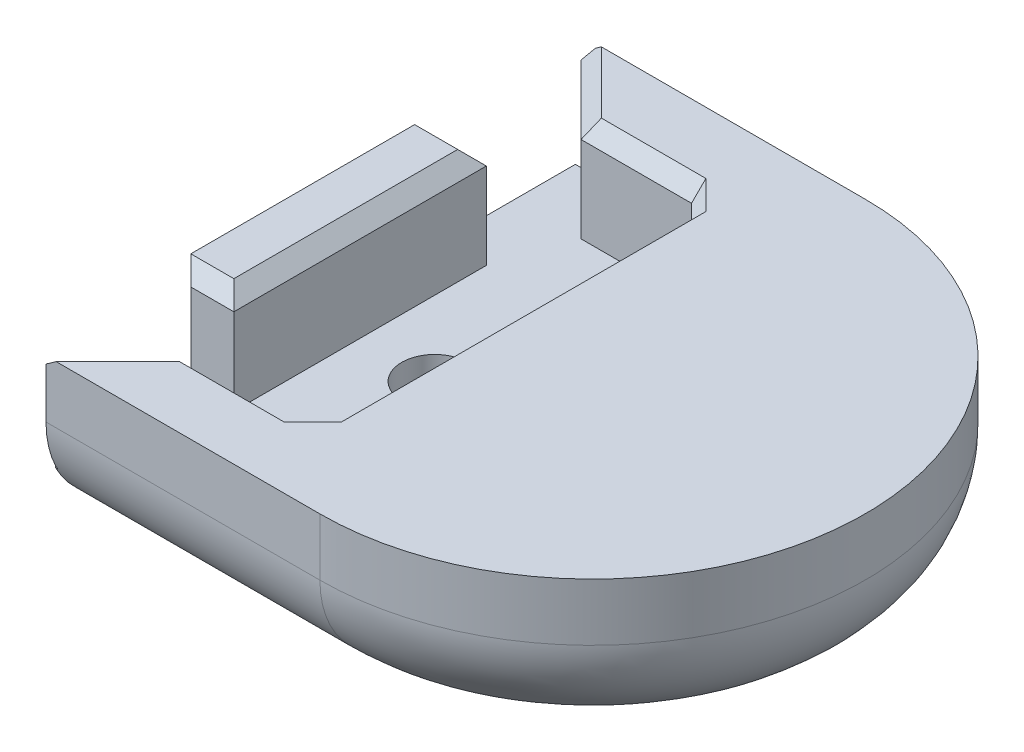
from build123d import *
from OCP.BRepFilletAPI import BRepFilletAPI_MakeChamfer

# Parameters (mm, degrees)
BOSS_EXTRUDE1_DEPTH     = 2
BOSS_EXTRUDE2_START     = 3.5
BOSS_EXTRUDE2_DEPTH     = 3.5
CUT_EXTRUDE1_DEPTH      = 15.300699284
CUT_EXTRUDE1_DEPTH_BACK = 15.300699284
SKETCH4_R               = 1.15
CUT_EXTRUDE2_DEPTH      = 1
CHAMFER1_SIZE           = 0.5
CHAMFER1_SIZE2          = 0.353553391
FILLET1_R               = 3.5
CHAMFER2_SIZE           = 0.5


with BuildPart() as part:
    # Sketch1 → Boss-Extrude1 (new body)
    with BuildSketch(Plane(origin=(0, 0, 0), x_dir=(1, 0, 0), z_dir=(0, 1, 0))):
        with BuildLine():
            Line((-10.1, -4.5), (-10.1, 4.5))
            Line((-10.1, 4.5), (-10.1, 9.5))
            Line((-10.1, 9.5), (0, 9.5))
            ThreePointArc((0, 9.5), (9.5, 0), (0, -9.5))
            Line((0, -9.5), (-10.1, -9.5))
            Line((-10.1, -9.5), (-10.1, -4.5))
        make_face()
    extrude(amount=-BOSS_EXTRUDE1_DEPTH)

    # Sketch2 → Boss-Extrude2 (add)
    with BuildSketch(Plane(origin=(0, 0, 0), x_dir=(1, 0, 0), z_dir=(0, 1, 0)).offset(BOSS_EXTRUDE2_START)):
        Polygon((-10.1, 4.4), (-8.1, 4.4), (-8.1, -4.4), (-10.1, -4.4), (-10.1, 0), align=None)
        with BuildLine():
            Line((-9.9, 9.5), (-7.25, 6.85))
            Line((-7.25, 6.85), (-2.9, 6.85))
            Line((-2.9, 6.85), (-2.9, -6.85))
            Line((-2.9, -6.85), (-7.25, -6.85))
            Line((-7.25, -6.85), (-9.9, -9.5))
            Line((-9.9, -9.5), (0, -9.5))
            ThreePointArc((0, -9.5), (9.5, 0), (0, 9.5))
            Line((0, 9.5), (-9.9, 9.5))
        make_face()
    extrude(amount=-BOSS_EXTRUDE2_DEPTH)

    # Sketch4 → Cut-Extrude1 (cut, two sides: drawn at the far end of the back side and taken through both)
    with BuildSketch(Plane(origin=(0, 0, 0), x_dir=(1, 0, 0), z_dir=(0, 1, 0)).offset(-CUT_EXTRUDE1_DEPTH_BACK)):
        with Locations(Location((-5.5, 0, 0), (0, 0, 270))):
            Circle(SKETCH4_R)
    extrude(amount=CUT_EXTRUDE1_DEPTH + CUT_EXTRUDE1_DEPTH_BACK, mode=Mode.SUBTRACT)

    # Sketch14 → Cut-Extrude2 (cut)
    with BuildSketch(Plane.XZ.offset(2)):
        Polygon((-6.654700538, 2), (-4.345299462, 2), (-3.190598923, 0), (-4.345299462, -2), (-6.654700538, -2), (-7.809401077, 0), align=None)
    extrude(amount=-CUT_EXTRUDE2_DEPTH, mode=Mode.SUBTRACT)

    # Chamfer1: one chamfer whose edges measure the first distance from different faces: ONE call of the kernel's chamfer builder (chamfer() names one face for all edges)
    chamfer1_edges_1 = [part.edges().sort_by_distance(p)[0] for p in [
        (-10.1, 0, 6.95),
        (-10.1, 1.75, -4.4),
        (-10.1, 1.75, 4.4),
        (-9.1, 3.5, 4.4),
        (-8.1, 3.5, 0),
        (-9.1, 3.5, -4.4),
        (-10, 0, -9.5),
        (-2.9, 1.75, -6.85),
        (-2.9, 1.75, 6.85),
        (-8.575, 3.5, -8.175),
        (-5.075, 3.5, -6.85),
        (-2.9, 3.5, 0),
        (-5.075, 3.5, 6.85),
        (-8.575, 3.5, 8.175),
        (-7.232050808, -2, 1),
        (-7.232050808, -2, -1),
        (-5.5, -2, -2),
        (-3.767949192, -2, -1),
        (-3.767949192, -2, 1),
        (-5.5, -2, 2),
        (-10, 0, 9.5),
        (-10.1, 0, -6.95),
    ]]
    chamfer1_edges_2 = [part.edges().sort_by_distance(p)[0] for p in [
        (-9.9, 1.75, -9.5),
    ]]
    chamfer1_side_2 = [part.faces().sort_by_distance(p)[0] for p in [
        (-4.986827712, 0.737237922, -9.5),
    ]]
    chamfer1_edges_3 = [part.edges().sort_by_distance(p)[0] for p in [
        (-9.9, 1.75, 9.5),
    ]]
    chamfer1_side_3 = [part.faces().sort_by_distance(p)[0] for p in [
        (-8.575, 1.75, 8.175),
    ]]
    chamfer1 = BRepFilletAPI_MakeChamfer(part.part.solid().wrapped)
    for e in chamfer1_edges_1:
        chamfer1.Add(CHAMFER1_SIZE, e.wrapped)
    for e in chamfer1_edges_2:
        chamfer1.Add(CHAMFER1_SIZE, CHAMFER1_SIZE2, e.wrapped, chamfer1_side_2[0].wrapped)  # the first distance lies on this face
    for e in chamfer1_edges_3:
        chamfer1.Add(CHAMFER1_SIZE, CHAMFER1_SIZE2, e.wrapped, chamfer1_side_3[0].wrapped)  # the first distance lies on this face
    add(Compound.cast(chamfer1.Shape()), mode=Mode.REPLACE)

    # Fillet1
    # the kernel refuses this fillet: 3.5 mm, written as the material it takes off along each edge
    with BuildSketch(Plane(origin=(0, -2, 9.5), x_dir=(0, 1, 0), z_dir=(-1, 0, 0))) as fillet1_piece_1:
        with BuildLine():
            CenterArc((FILLET1_R, FILLET1_R), FILLET1_R, 180, 90)
            Line((0, FILLET1_R), (0, 0))
            Line((0, 0), (FILLET1_R, 0))
        make_face()
    extrude(amount=18.85, mode=Mode.SUBTRACT)
    with BuildSketch(Plane(origin=(-18.85, -2, -9.5), x_dir=(0, 0, 1), z_dir=(1, 0, 0))) as fillet1_piece_2:
        with BuildLine():
            CenterArc((FILLET1_R, -FILLET1_R), FILLET1_R, 90, 90)
            Line((0, -FILLET1_R), (0, 0))
            Line((0, 0), (FILLET1_R, 0))
        make_face()
    extrude(amount=18.85, mode=Mode.SUBTRACT)
    with BuildSketch(Plane(origin=(0, -2, 0), x_dir=(0, 0, -1), z_dir=(-1, 0, 0))) as fillet1_piece_3:
        with BuildLine():
            CenterArc((9.5 - FILLET1_R, -FILLET1_R), FILLET1_R, 0, 90)
            Line((9.5, -FILLET1_R), (9.5, 0))
            Line((9.5, 0), (9.5 - FILLET1_R, 0))
        make_face()
    revolve(axis=Axis((0, -2, 0), (0, -1, 0)), revolution_arc=180, mode=Mode.SUBTRACT)

    # Chamfer2
    chamfer2_edges = [part.edges().sort_by_distance(p)[0] for p in [
        (-10.1, -1.602418411, -7.620185175),
        (-10.1, -1.602418411, 7.620185175),
        (-10.1, -2, 0),
    ]]
    chamfer(chamfer2_edges, length=CHAMFER2_SIZE)


solid = part.part
